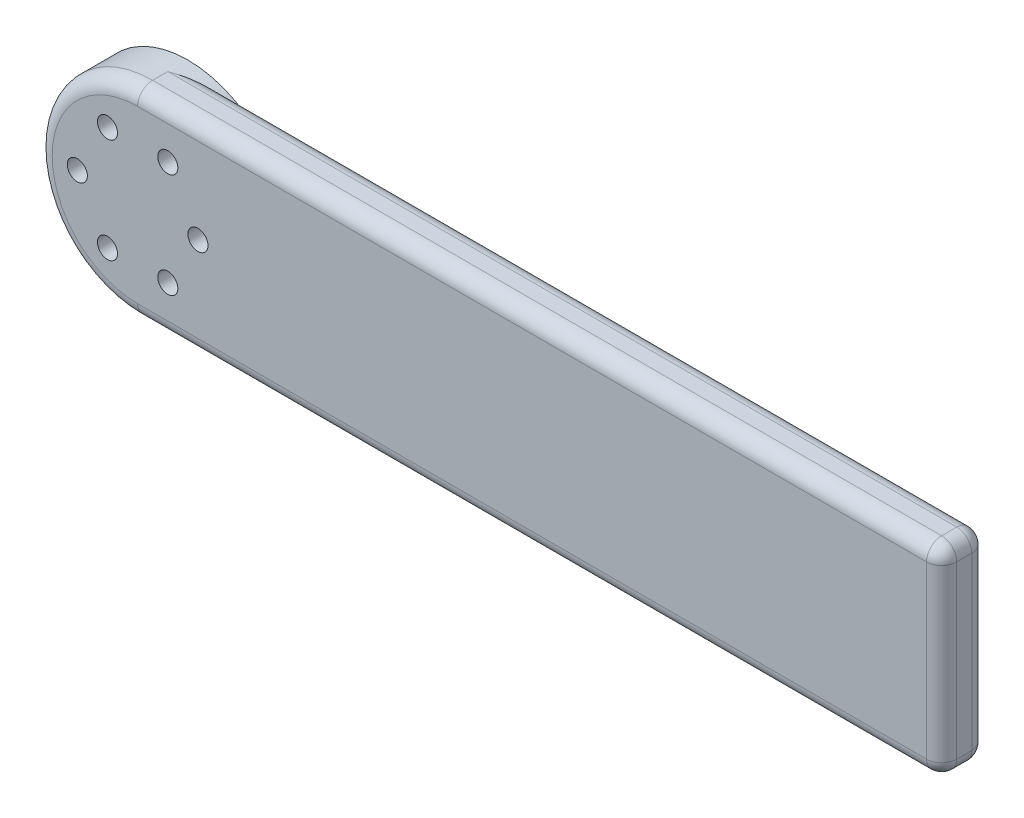
from build123d import *

# Parameters (mm, degrees)
SKETCH8_R             = 20
BOSS_EXTRUDE6_DEPTH   = 10
BOSS_EXTRUDE7_START   = 1
BOSS_EXTRUDE7_DEPTH   = 9
F_4_0MM_DOWEL_HOLE2_D = 4
FILLET4_R             = 3


with BuildPart() as part:
    # Sketch8 → Boss-Extrude6 (new body)
    with BuildSketch(Plane.XY):
        Circle(SKETCH8_R)
    extrude(amount=BOSS_EXTRUDE6_DEPTH)

    # Sketch8<4> → Boss-Extrude7 (add)
    with BuildSketch(Plane.XY.offset(BOSS_EXTRUDE7_START)):
        with BuildLine():
            Line((160, 20), (0, 20))
            ThreePointArc((0, 20), (14.142135624, 14.142135624), (20, 0))
            ThreePointArc((20, 0), (14.142135624, -14.142135624), (0, -20))
            Line((0, -20), (160, -20))
            Line((160, -20), (160, 20))
        make_face()
    extrude(amount=BOSS_EXTRUDE7_DEPTH)

    # Ø4.0mm Dowel Hole2 (through all)
    with Locations(Plane.XY.offset(10)):
        with Locations((6, 10.392304845), (12, 0), (6, -10.392304845), (-6, -10.392304845), (-12, 0), (-6, 10.392304845)):
            Hole(F_4_0MM_DOWEL_HOLE2_D / 2)

    # Fillet4
    # the kernel refuses this fillet: 3 mm, written as the material it takes off along each edge
    with BuildSketch(Plane(origin=(157, 17, 4), x_dir=(1, 0, 0), z_dir=(0, 0, -1))) as fillet4_piece_1_section:
        Polygon((0, 0), (FILLET4_R, 0), (FILLET4_R, -FILLET4_R), (0, -FILLET4_R), align=None)
    fillet4_piece_1 = extrude(amount=FILLET4_R, mode=Mode.PRIVATE)
    fillet4_piece_1 = fillet4_piece_1 - Plane(origin=(157, 17, 4), x_dir=(-0.7071067811865475, -0.7071067811865475, 0), z_dir=(0, 0, -1)) * Sphere(FILLET4_R, mode=Mode.PRIVATE)
    add(fillet4_piece_1, mode=Mode.SUBTRACT)
    with BuildSketch(Plane(origin=(157, 17, 7), x_dir=(1, 0, 0), z_dir=(0, 0, 1))) as fillet4_piece_2_section:
        Polygon((0, 0), (FILLET4_R, 0), (FILLET4_R, FILLET4_R), (0, FILLET4_R), align=None)
    fillet4_piece_2 = extrude(amount=FILLET4_R, mode=Mode.PRIVATE)
    fillet4_piece_2 = fillet4_piece_2 - Plane(origin=(157, 17, 7), x_dir=(-0.7071067811865475, -0.7071067811865475, 0), z_dir=(0, 0, 1)) * Sphere(FILLET4_R, mode=Mode.PRIVATE)
    add(fillet4_piece_2, mode=Mode.SUBTRACT)
    with BuildSketch(Plane(origin=(157, -17, 4), x_dir=(0, -1, 0), z_dir=(0, 0, -1))) as fillet4_piece_3_section:
        Polygon((0, 0), (FILLET4_R, 0), (FILLET4_R, -FILLET4_R), (0, -FILLET4_R), align=None)
    fillet4_piece_3 = extrude(amount=FILLET4_R, mode=Mode.PRIVATE)
    fillet4_piece_3 = fillet4_piece_3 - Plane(origin=(157, -17, 4), x_dir=(-0.7071067811865475, 0.7071067811865475, 0), z_dir=(0, 0, -1)) * Sphere(FILLET4_R, mode=Mode.PRIVATE)
    add(fillet4_piece_3, mode=Mode.SUBTRACT)
    with BuildSketch(Plane(origin=(157, -17, 7), x_dir=(0, 0, 1), z_dir=(0, -1, 0))) as fillet4_piece_4_section:
        Polygon((0, 0), (FILLET4_R, 0), (FILLET4_R, -FILLET4_R), (0, -FILLET4_R), align=None)
    fillet4_piece_4 = extrude(amount=FILLET4_R, mode=Mode.PRIVATE)
    fillet4_piece_4 = fillet4_piece_4 - Plane(origin=(157, -17, 7), x_dir=(-0.7071067811865475, 0, -0.7071067811865475), z_dir=(0, -1, 0)) * Sphere(FILLET4_R, mode=Mode.PRIVATE)
    add(fillet4_piece_4, mode=Mode.SUBTRACT)
    with BuildSketch(Plane(origin=(160, 20, 4), x_dir=(-1, 0, 0), z_dir=(0, 0, 1))) as fillet4_piece_5:
        with BuildLine():
            CenterArc((FILLET4_R, FILLET4_R), FILLET4_R, 180, 90)
            Line((0, FILLET4_R), (0, 0))
            Line((0, 0), (FILLET4_R, 0))
        make_face()
    extrude(amount=3, mode=Mode.SUBTRACT)
    with BuildSketch(Plane(origin=(157, 20, 1), x_dir=(0, -1, 0), z_dir=(-1, 0, 0))) as fillet4_piece_6_section:
        with BuildLine():
            CenterArc((FILLET4_R, FILLET4_R), FILLET4_R, 180, 90)
            Line((0, FILLET4_R), (0, 0))
            Line((0, 0), (FILLET4_R, 0))
        make_face()
    fillet4_piece_6 = extrude(amount=164.5, mode=Mode.PRIVATE)
    fillet4_piece_6 = fillet4_piece_6 - Plane(origin=(0, 0, 1.692410686), x_dir=(1, 0, 0), z_dir=(0, 0, -1)) * Cylinder(20, 341, mode=Mode.PRIVATE)
    add(fillet4_piece_6, mode=Mode.SUBTRACT)
    with BuildSketch(Plane(origin=(160, -17, 1), x_dir=(-1, 0, 0), z_dir=(0, 1, 0))) as fillet4_piece_7:
        with BuildLine():
            CenterArc((FILLET4_R, FILLET4_R), FILLET4_R, 180, 90)
            Line((0, FILLET4_R), (0, 0))
            Line((0, 0), (FILLET4_R, 0))
        make_face()
    extrude(amount=34, mode=Mode.SUBTRACT)
    with BuildSketch(Plane(origin=(-7.5, -20, 1), x_dir=(0, 1, 0), z_dir=(1, 0, 0))) as fillet4_piece_8_section:
        with BuildLine():
            CenterArc((FILLET4_R, FILLET4_R), FILLET4_R, 180, 90)
            Line((0, FILLET4_R), (0, 0))
            Line((0, 0), (FILLET4_R, 0))
        make_face()
    fillet4_piece_8 = extrude(amount=164.5, mode=Mode.PRIVATE)
    fillet4_piece_8 = fillet4_piece_8 - Plane(origin=(0, 0, 1.692408431), x_dir=(1, 0, 0), z_dir=(0, 0, -1)) * Cylinder(20, 341, mode=Mode.PRIVATE)
    add(fillet4_piece_8, mode=Mode.SUBTRACT)
    with BuildSketch(Plane(origin=(0, 0, 10), x_dir=(0, 1, 0), z_dir=(1, 0, 0))) as fillet4_piece_9:
        with BuildLine():
            CenterArc((20 - FILLET4_R, -FILLET4_R), FILLET4_R, 0, 90)
            Line((20 - FILLET4_R, 0), (20, 0))
            Line((20, 0), (20, -FILLET4_R))
        make_face()
    revolve(axis=Axis((0, 0, 10), (0, 0, 1)), revolution_arc=180, mode=Mode.SUBTRACT)
    with BuildSketch(Plane(origin=(0, -20, 10), x_dir=(0, 0, -1), z_dir=(1, 0, 0))) as fillet4_piece_10:
        with BuildLine():
            CenterArc((FILLET4_R, FILLET4_R), FILLET4_R, 180, 90)
            Line((0, FILLET4_R), (0, 0))
            Line((0, 0), (FILLET4_R, 0))
        make_face()
    extrude(amount=157, mode=Mode.SUBTRACT)
    with BuildSketch(Plane(origin=(160, -17, 10), x_dir=(-1, 0, 0), z_dir=(0, 1, 0))) as fillet4_piece_11:
        with BuildLine():
            CenterArc((FILLET4_R, -FILLET4_R), FILLET4_R, 90, 90)
            Line((0, -FILLET4_R), (0, 0))
            Line((0, 0), (FILLET4_R, 0))
        make_face()
    extrude(amount=34, mode=Mode.SUBTRACT)
    with BuildSketch(Plane(origin=(160, -20, 4), x_dir=(-1, 0, 0), z_dir=(0, 0, 1))) as fillet4_piece_12:
        with BuildLine():
            CenterArc((FILLET4_R, -FILLET4_R), FILLET4_R, 90, 90)
            Line((0, -FILLET4_R), (0, 0))
            Line((0, 0), (FILLET4_R, 0))
        make_face()
    extrude(amount=3, mode=Mode.SUBTRACT)
    with BuildSketch(Plane(origin=(157, 20, 10), x_dir=(0, -1, 0), z_dir=(-1, 0, 0))) as fillet4_piece_13:
        with BuildLine():
            CenterArc((FILLET4_R, -FILLET4_R), FILLET4_R, 90, 90)
            Line((0, -FILLET4_R), (0, 0))
            Line((0, 0), (FILLET4_R, 0))
        make_face()
    extrude(amount=157, mode=Mode.SUBTRACT)


solid = part.part
